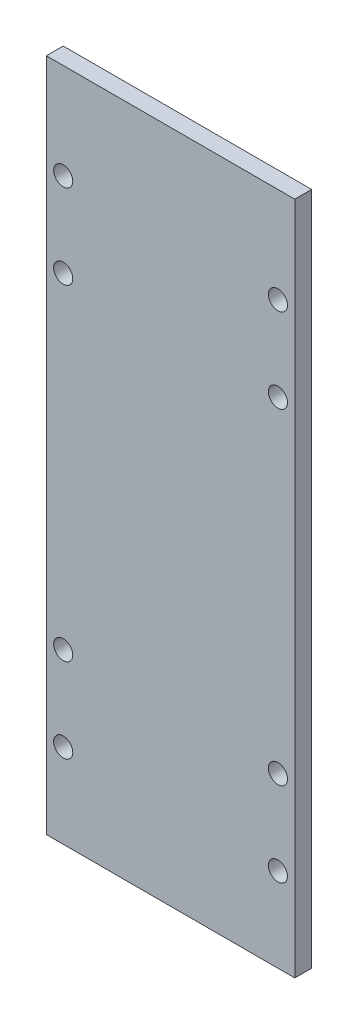
from build123d import *

# Parameters (mm, degrees)
SKETCH_D_W               = 44.2
SKETCH_D_H               = 120
BOSS_EXTRUDE1_DEPTH      = 3
M3_CLEARANCE_HOLE1_D     = 3.4
M3_CLEARANCE_HOLE1_DEPTH = 15
M3_CLEARANCE_HOLE1_TIP   = 1.021463052


with BuildPart() as part:
    # Sketch d → Boss-Extrude1 (new body)
    with BuildSketch(Plane.XY):
        with Locations((0.312368929, 10.469782369)):
            Rectangle(SKETCH_D_W, SKETCH_D_H)
    extrude(amount=BOSS_EXTRUDE1_DEPTH)

    # M3 Clearance Hole1
    with Locations(Plane.XY.offset(3)):
        with Locations((-18.787631071, 53.469782369), (-18.787631071, 38.469782369), (-18.787631071, -19.530217631), (-18.787631071, -34.530217631), (19.412368929, -34.530217631), (19.412368929, -19.530217631), (19.412368929, 38.469782369), (19.412368929, 53.469782369)):
            Hole(M3_CLEARANCE_HOLE1_D / 2, depth=M3_CLEARANCE_HOLE1_DEPTH)
            with Locations((0, 0, -(M3_CLEARANCE_HOLE1_DEPTH + M3_CLEARANCE_HOLE1_TIP / 2))):  # 118° drill point
                Cone(0, M3_CLEARANCE_HOLE1_D / 2, M3_CLEARANCE_HOLE1_TIP, mode=Mode.SUBTRACT)


solid = part.part
